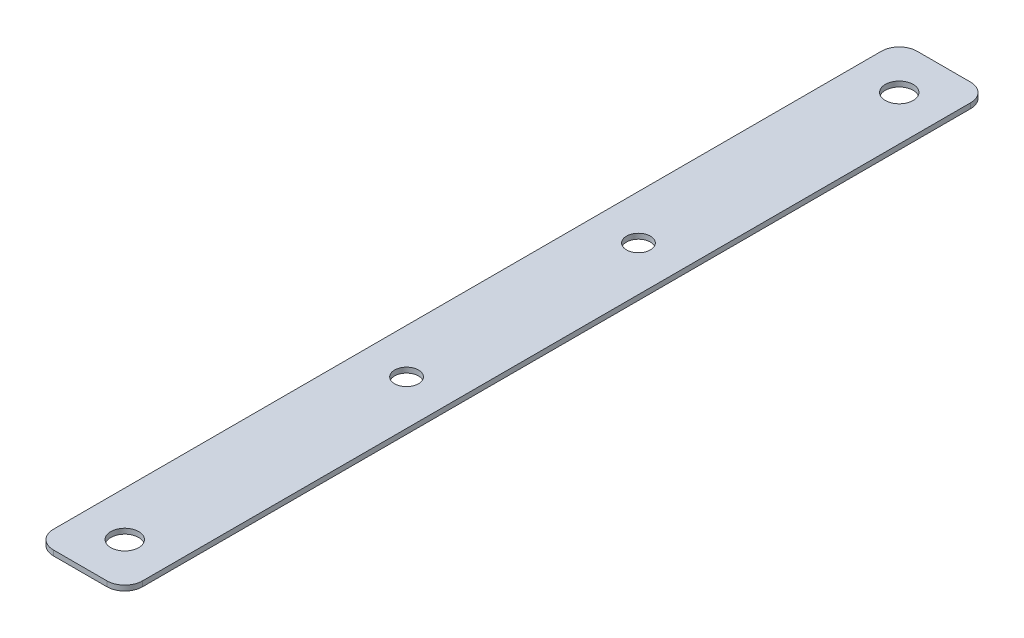
from build123d import *

# Parameters (mm, degrees)
SKETCH1_W                       = 12.7
SKETCH1_H                       = 122.9106
BASE_FLANGE2_DEPTH              = 0.7366
M3_CLEARANCE_HOLE1_D            = 3.4
F_5_32_0_15625_DIAMETER_HOLE1_D = 3.96875
BREAK_CORNER1_START             = -0.7366
BREAK_CORNER1_DEPTH             = 0.7366


# Read off the part's stored shape, not the designer's step: Break-Corner1
# Sheet-metal steps are written as plain solids
with BuildPart() as part:
    # Sketch1 → Base-Flange2 (new body)
    with BuildSketch(Plane(origin=(0, 0, 0), x_dir=(1, 0, 0), z_dir=(0, 1, 0))):
        with Locations((6.35, 61.4553)):
            Rectangle(SKETCH1_W, SKETCH1_H)
    extrude(amount=-BASE_FLANGE2_DEPTH)

    # M3 Clearance Hole1 (through all)
    with Locations(Plane(origin=(0, 0, 0), x_dir=(1, 0, 0), z_dir=(0, 1, 0))):
        with Locations((6.35, 46.4512), (6.35, 79.4512)):
            Hole(M3_CLEARANCE_HOLE1_D / 2)

    # 5/32 (0.15625) Diameter Hole1 (through all)
    with Locations(Plane(origin=(0, 0, 0), x_dir=(1, 0, 0), z_dir=(0, 1, 0))):
        with Locations((6.35, 116.5606), (6.35, 6.35)):
            Hole(F_5_32_0_15625_DIAMETER_HOLE1_D / 2)

    # Break-Corner1 outline → Break-Corner1 (cut)
    with BuildSketch(Plane(origin=(0, 0, 0), x_dir=(1, 0, 0), z_dir=(0, 1, 0)).offset(BREAK_CORNER1_START)):
        with BuildLine():
            ThreePointArc((2.54, 0), (0.743948776, 0.743948776), (0, 2.54))
            Line((0, 2.54), (0, 0))
            Line((0, 0), (2.54, 0))
        make_face()
        with BuildLine():
            Line((0, 122.9106), (0, 120.3706))
            ThreePointArc((0, 120.3706), (0.743948776, 122.166651224), (2.54, 122.9106))
            Line((2.54, 122.9106), (0, 122.9106))
        make_face()
        with BuildLine():
            ThreePointArc((12.7, 2.54), (11.956051224, 0.743948776), (10.16, 0))
            Line((10.16, 0), (12.7, 0))
            Line((12.7, 0), (12.7, 2.54))
        make_face()
        with BuildLine():
            Line((12.7, 122.9106), (10.16, 122.9106))
            ThreePointArc((10.16, 122.9106), (11.956051224, 122.166651224), (12.7, 120.3706))
            Line((12.7, 120.3706), (12.7, 122.9106))
        make_face()
    extrude(amount=BREAK_CORNER1_DEPTH, mode=Mode.SUBTRACT)


solid = part.part
